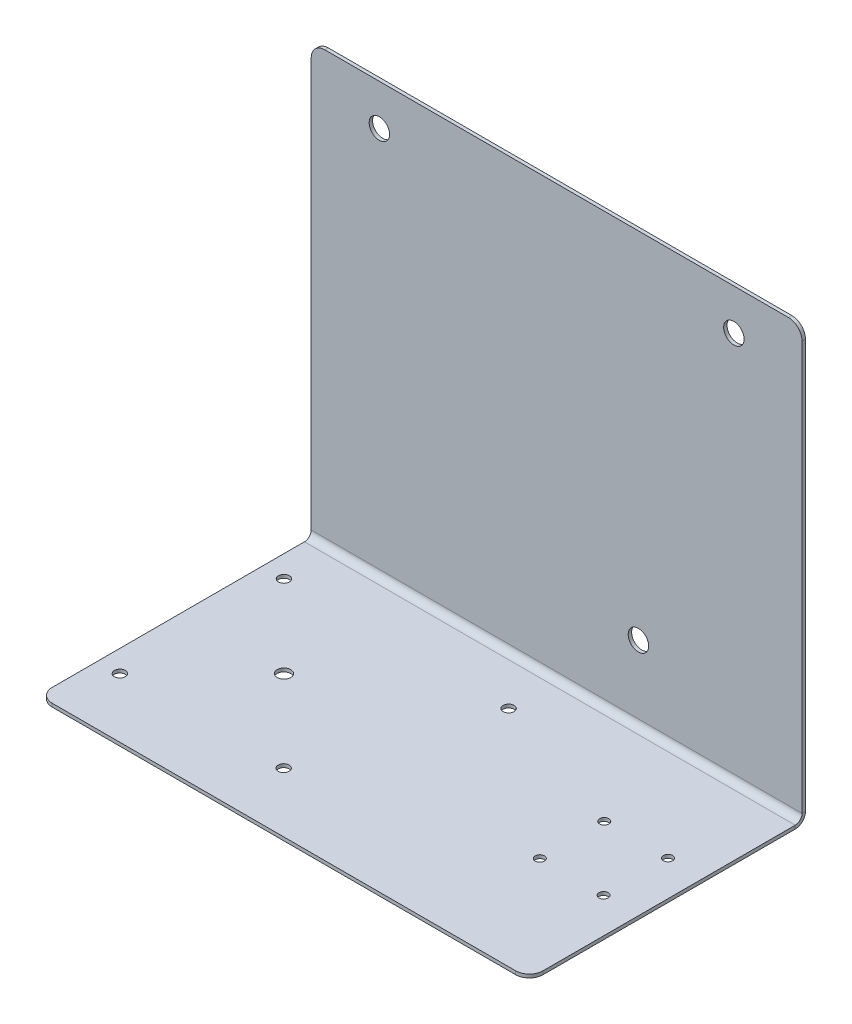
from build123d import *

# Parameters (mm, degrees)
SKETCH2_W            = 228.6
SKETCH2_H            = 203.2
BOSS_EXTRUDE1_DEPTH  = 3.175
SKETCH3_W            = 228.6
SKETCH3_H            = 3.175
BOSS_EXTRUDE2_DEPTH  = 127
FILLET1_R            = 3.175
FILLET2_R            = 6.35
SKETCH4_R            = 2.54
SKETCH4_R_2          = 2.15
SKETCH4_R_3          = 3.175
CUT_EXTRUDE1_DEPTH   = 265.612965007
CONVERT_SOLID1_START = -114.3
CONVERT_SOLID1_DEPTH = 228.6
SKETCH9_R            = 4.7625
CUT_EXTRUDE2_DEPTH   = 199.7864432


# Read off the part's stored shape, not the designer's step: Convert-Solid1
with BuildPart() as part:
    # Sketch2 → Boss-Extrude1 (new body)
    with BuildSketch(Plane.XY):
        Rectangle(SKETCH2_W, SKETCH2_H)
    extrude(amount=BOSS_EXTRUDE1_DEPTH)

    # Sketch3 → Boss-Extrude2 (add)
    with BuildSketch(Plane.XY.offset(3.175)):
        with Locations((0, -100.0125)):
            Rectangle(SKETCH3_W, SKETCH3_H)
    extrude(amount=BOSS_EXTRUDE2_DEPTH)

    # Fillet1
    fillet1_edges = [part.edges().sort_by_distance(p)[0] for p in [
        (0, -98.425, 3.175),
        (0, -101.6, 0),
    ]]
    fillet(fillet1_edges, radius=FILLET1_R)

    # Fillet2
    fillet2_edges = [part.edges().sort_by_distance(p)[0] for p in [
        (-114.3, -100.0125, 130.175),
        (114.3, -100.0125, 130.175),
        (-114.3, 101.6, 1.5875),
        (114.3, 101.6, 1.5875),
    ]]
    fillet(fillet2_edges, radius=FILLET2_R)

    # Sketch4 → Cut-Extrude1 (cut, through all)
    with BuildSketch(Plane(origin=(0, -98.425, 0), x_dir=(1, 0, 0), z_dir=(0, 1, 0))):
        with Locations(Location((-104.14, -26.035, 0), (0, 0, 270))):
            Circle(SKETCH4_R)
        with Locations(Location((-104.14, -102.4636, 0), (0, 0, 270))):
            Circle(SKETCH4_R)
        with Locations(Location((0.4826, -26.035, 0), (0, 0, 270))):
            Circle(SKETCH4_R)
        with Locations(Location((-27.8257, -102.4636, 0), (0, 0, 270))):
            Circle(SKETCH4_R)
        with Locations(Location((68.25, -79.2493, 0), (0, 0, 270))):
            Circle(SKETCH4_R_2)
        with Locations(Location((97.95, -79.2493, 0), (0, 0, 270))):
            Circle(SKETCH4_R_2)
        with Locations(Location((68.25, -49.2493, 0), (0, 0, 270))):
            Circle(SKETCH4_R_2)
        with Locations(Location((97.95, -49.2493, 0), (0, 0, 270))):
            Circle(SKETCH4_R_2)
        with Locations(Location((-65.9257, -64.2493, 0), (0, 0, 270))):
            Circle(SKETCH4_R_3)
    extrude(amount=-CUT_EXTRUDE1_DEPTH, mode=Mode.SUBTRACT)

    # Convert-Solid1 outline → Convert-Solid1 (cut)
    with BuildSketch(Plane.YZ.offset(CONVERT_SOLID1_START)):
        with BuildLine():
            ThreePointArc((-95.25, 1.5875), (-98.617596045, 2.982403955), (-100.0125, 6.35))
            Line((-100.0125, 6.35), (-100.0125, 130.175))
            Line((-100.0125, 130.175), (-101.6, 130.175))
            Line((-101.6, 130.175), (-101.6, 3.175))
            ThreePointArc((-101.6, 3.175), (-100.67006403, 0.92993597), (-98.425, 0))
            Line((-98.425, 0), (101.6, 0))
            Line((101.6, 0), (101.6, 1.5875))
            Line((101.6, 1.5875), (-95.25, 1.5875))
        make_face()
    extrude(amount=CONVERT_SOLID1_DEPTH, mode=Mode.SUBTRACT)

    # Sketch9 → Cut-Extrude2 (cut, through all)
    with BuildSketch(Plane.XY.offset(3.175)):
        with Locations((-82.55, 82.55)):
            Circle(SKETCH9_R)
        with Locations((82.55, 82.55)):
            Circle(SKETCH9_R)
        with Locations((38.1, -63.5)):
            Circle(SKETCH9_R)
    extrude(amount=-CUT_EXTRUDE2_DEPTH, mode=Mode.SUBTRACT)


solid = part.part
